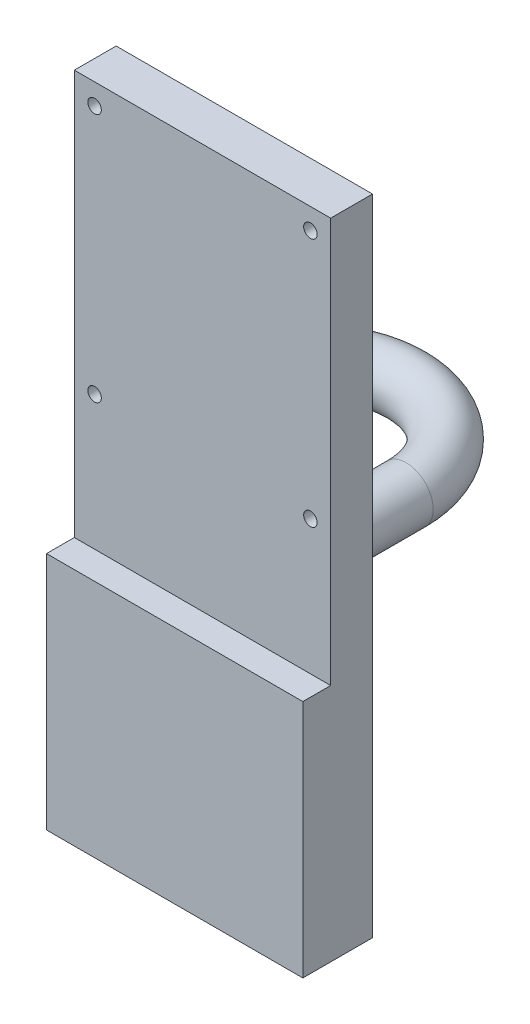
from build123d import *

# Parameters (mm, degrees)
ESQUISSE1_W             = 190
ESQUISSE1_H             = 300
BOSS_EXTRU_1_DEPTH      = 31
ESQUISSE2_R             = 5
ENL_V_MAT_EXTRU_1_DEPTH = 357.456168413
ESQUISSE3_W             = 190
ESQUISSE3_H             = 51.62
BOSS_EXTRU_2_DEPTH      = 177.45
ESQUISSE4_R             = 20
BOSS_EXTRU_3_DEPTH      = 50
ESQUISSE6_R             = 20
R_VOLUTION1_ANGLE       = 180


with BuildPart() as part:
    # Esquisse1 → Boss.-Extru.1 (new body)
    with BuildSketch(Plane.XY):
        with Locations((95, 150)):
            Rectangle(ESQUISSE1_W, ESQUISSE1_H)
    extrude(amount=BOSS_EXTRU_1_DEPTH)

    # Esquisse2 → Enlèv. mat.-Extru.1 (cut, through all)
    with BuildSketch(Plane(origin=(0, 0, 0), x_dir=(-1, 0, 0), z_dir=(0, 0, -1))):
        with Locations((-175, 284.5)):
            Circle(ESQUISSE2_R)
        with Locations((-15, 284.5)):
            Circle(ESQUISSE2_R)
        with Locations((-175, 99.5)):
            Circle(ESQUISSE2_R)
        with Locations((-15, 99.5)):
            Circle(ESQUISSE2_R)
    extrude(amount=-ENL_V_MAT_EXTRU_1_DEPTH, mode=Mode.SUBTRACT)

    # Esquisse3 → Boss.-Extru.2 (add)
    with BuildSketch(Plane.XZ):
        with Locations((95, 25.81)):
            Rectangle(ESQUISSE3_W, ESQUISSE3_H)
    extrude(amount=BOSS_EXTRU_2_DEPTH)

    # Esquisse4 → Boss.-Extru.3 (add)
    with BuildSketch(Plane(origin=(0, 0, 0), x_dir=(-1, 0, 0), z_dir=(0, 0, -1))):
        with Locations((-165, 70)):
            Circle(ESQUISSE4_R)
    boss_extru_3 = extrude(amount=BOSS_EXTRU_3_DEPTH)

    # Symétrie1: Boss.-Extru.3 across plane
    add(boss_extru_3.mirror(Plane(origin=(95, 0, 0), x_dir=(0, 0, 1), z_dir=(1, 0, 0))))

    # Esquisse6 → Révolution1 (revolve)
    with BuildSketch(Plane(origin=(0, 0, -50), x_dir=(-1, 0, 0), z_dir=(0, 0, -1))):
        with Locations((-165, 70)):
            Circle(ESQUISSE6_R)
    revolve(axis=Axis((95, -201.3225, -50), (0, 1, 0)), revolution_arc=R_VOLUTION1_ANGLE)


solid = part.part
